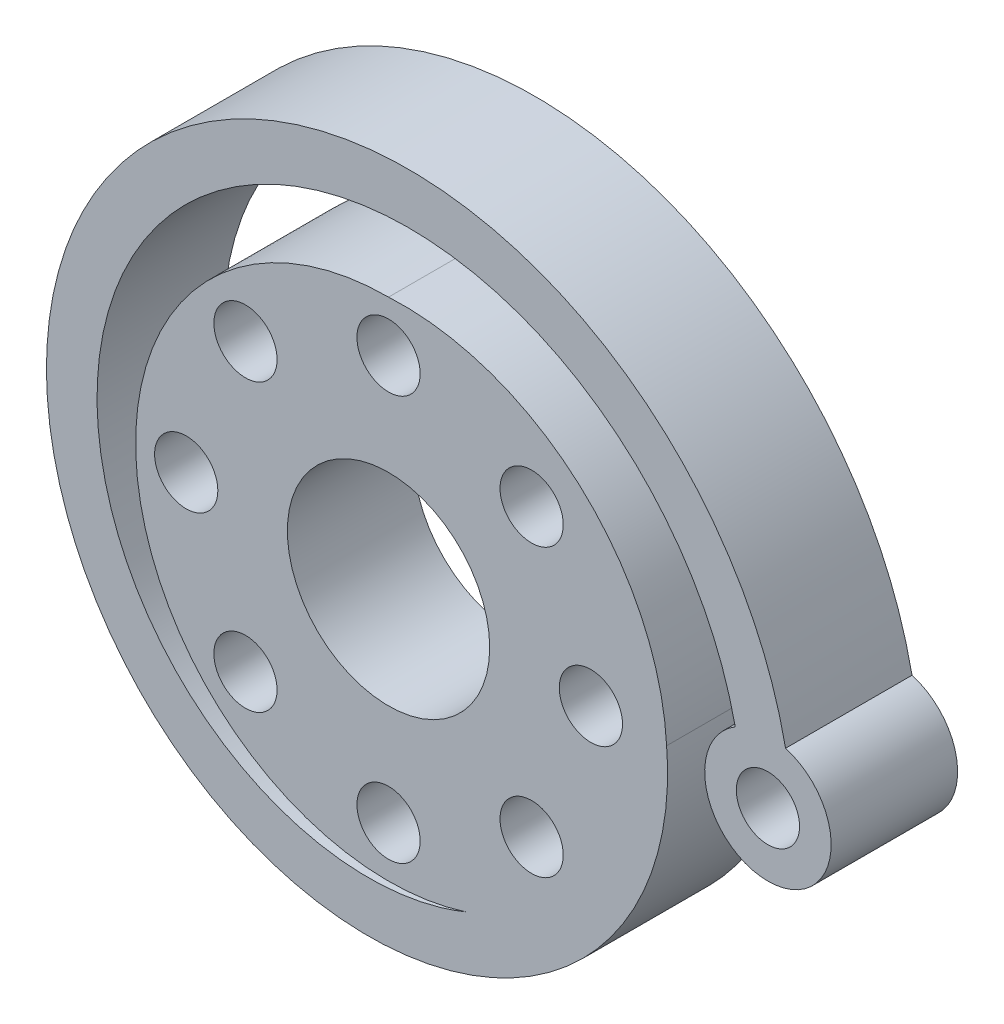
from build123d import *

# Parameters (mm, degrees)
SKETCH1_R           = 10
SKETCH1_R_2         = 4
BOSS_EXTRUDE1_DEPTH = 2.5
SWEEP3_START        = -2.5
SWEEP3_DEPTH        = 5
BOSS_EXTRUDE4_DEPTH = 2.5
SKETCH16_R          = 1.25
CUT_EXTRUDE3_DEPTH  = 23.342791991
SKETCH17_R          = 2.5
BOSS_EXTRUDE6_DEPTH = 5
SKETCH19_R          = 1.25
CUT_EXTRUDE8_DEPTH  = 24.441315856


# Read off the part's stored shape, not the designer's step: Sweep3
with BuildPart() as part:
    # Sketch1 → Boss-Extrude1 (new, symmetric)
    with BuildSketch(Plane.XY):
        Circle(SKETCH1_R)
        Circle(SKETCH1_R_2, mode=Mode.SUBTRACT)
    extrude(amount=BOSS_EXTRUDE1_DEPTH, both=True)

    # Sweep3 outline → Sweep3 (add)
    with BuildSketch(Plane.XY.offset(SWEEP3_START)):
        with BuildLine():
            add(Edge.make_bspline(
                [(14.001404275, -0.052977149), (13.904173046, 1.780196521), (13.442565587, 3.572094196), (11.890877496, 6.809237043), (10.801709204, 8.253332904), (8.186966139, 10.592189091), (6.662651316, 11.486259684), (3.42736792, 12.614868217), (1.717797642, 12.849263513), (-1.621302533, 12.653562932), (-3.249518177, 12.223870491), (-6.183850481, 10.796270419), (-7.4889371, 9.799226246), (-9.595519252, 7.415006141), (-10.396416427, 6.02899944), (-11.398649051, 3.095578912), (-11.599891559, 1.549444602), (-11.402952782, -1.462408682), (-11.005175395, -2.926942158), (-9.701663343, -5.558463918), (-8.796743288, -6.724541295), (-6.643046144, -8.598849415), (-5.395347563, -9.306573168), (-2.763789906, -10.182429886), (-1.381091561, -10.350519603), (1.040427327, -10.171763686), (2.092847662, -9.919648115), (3.069076076, -9.517393133)],
                knots=[0, 0, 0, 0, 0.0625, 0.0625, 0.125, 0.125, 0.1875, 0.1875, 0.25, 0.25, 0.3125, 0.3125, 0.375, 0.375, 0.4375, 0.4375, 0.5, 0.5, 0.5625, 0.5625, 0.625, 0.625, 0.6875, 0.6875, 0.75, 0.75, 0.800250183, 0.800250183, 0.800250183, 0.800250183], degree=3))
            Line((14.001404275, -0.052977149), (15.998595725, 0.052977149))
            add(Edge.make_bspline(
                [(15.998595725, 0.052977149), (15.88727955, 2.151645773), (15.36105771, 4.196719949), (13.579387134, 7.913639429), (12.333386913, 9.566632433), (9.322020572, 12.260254967), (7.572650194, 13.287014766), (3.834835276, 14.590921671), (1.866465145, 14.861411913), (-2.004050658, 14.634559441), (-3.885126209, 14.138778854), (-7.298234063, 12.478239779), (-8.811431318, 11.323008142), (-11.270624066, 8.53969551), (-12.20290338, 6.927631835), (-13.377349106, 3.490143837), (-13.613013712, 1.684760102), (-13.381303715, -1.858765561), (-12.915628556, -3.575924925), (-11.375546669, -6.685018237), (-10.310768446, -8.058250389), (-7.754919009, -10.282533165), (-6.279916503, -11.120032821), (-3.142361815, -12.164293038), (-1.499841744, -12.364730806), (1.716789854, -12.127273583), (3.269990524, -11.691249995), (6.074797859, -10.270690198), (7.307834097, -9.295925842), (9.296545299, -6.96670873), (10.038849739, -5.628419319), (10.951909815, -2.790232385), (11.116570858, -1.310582106), (10.994320343, 0.134547868)],
                knots=[0, 0, 0, 0, 0.0625, 0.0625, 0.125, 0.125, 0.1875, 0.1875, 0.25, 0.25, 0.3125, 0.3125, 0.375, 0.375, 0.4375, 0.4375, 0.5, 0.5, 0.5625, 0.5625, 0.625, 0.625, 0.6875, 0.6875, 0.75, 0.75, 0.8125, 0.8125, 0.875, 0.875, 0.9375, 0.9375, 1, 1, 1, 1], degree=3))
            Line((10.994320343, 0.134547868), (9.999872925, 0.050413141))
            ThreePointArc((9.999872925, 0.050413141), (8.098461966, -5.866422571), (3.069076076, -9.517393133))
        make_face()
    extrude(amount=SWEEP3_DEPTH)

    # Sketch14 → Boss-Extrude4 (add, symmetric)
    with BuildSketch(Plane.XY):
        with BuildLine():
            ThreePointArc((0, 10), (7.540362208, 7.344272232), (10.994320343, 0.134547868))
            Line((10.994320343, 0.134547868), (9.999872925, 0.050413141))
            ThreePointArc((9.999872925, 0.050413141), (7.053221554, 7.088869142), (0, 10))
        make_face()
    extrude(amount=BOSS_EXTRUDE4_DEPTH, both=True)

    # Sketch16 → Cut-Extrude3 (cut, through all)
    with BuildSketch(Plane.XY.offset(2.5)):
        with Locations((8, 0)):
            Circle(SKETCH16_R)
        with Locations((5.656854249, -5.656854249)):
            Circle(SKETCH16_R)
        with Locations((0, -8)):
            Circle(SKETCH16_R)
        with Locations((-5.656854249, -5.656854249)):
            Circle(SKETCH16_R)
        with Locations((-8, 0)):
            Circle(SKETCH16_R)
        with Locations((-5.656854249, 5.656854249)):
            Circle(SKETCH16_R)
        with Locations((0, 8)):
            Circle(SKETCH16_R)
        with Locations((5.656854249, 5.656854249)):
            Circle(SKETCH16_R)
    extrude(amount=-CUT_EXTRUDE3_DEPTH, mode=Mode.SUBTRACT)

    # Sketch17 → Boss-Extrude6 (add)
    with BuildSketch(Plane.XY.offset(2.5)):
        with Locations((15, 0)):
            Circle(SKETCH17_R)
    extrude(amount=-BOSS_EXTRUDE6_DEPTH)

    # Sketch19 → Cut-Extrude8 (cut, through all)
    with BuildSketch(Plane.XY.offset(2.5)):
        with Locations((15, 0)):
            Circle(SKETCH19_R)
    extrude(amount=-CUT_EXTRUDE8_DEPTH, mode=Mode.SUBTRACT)


solid = part.part
